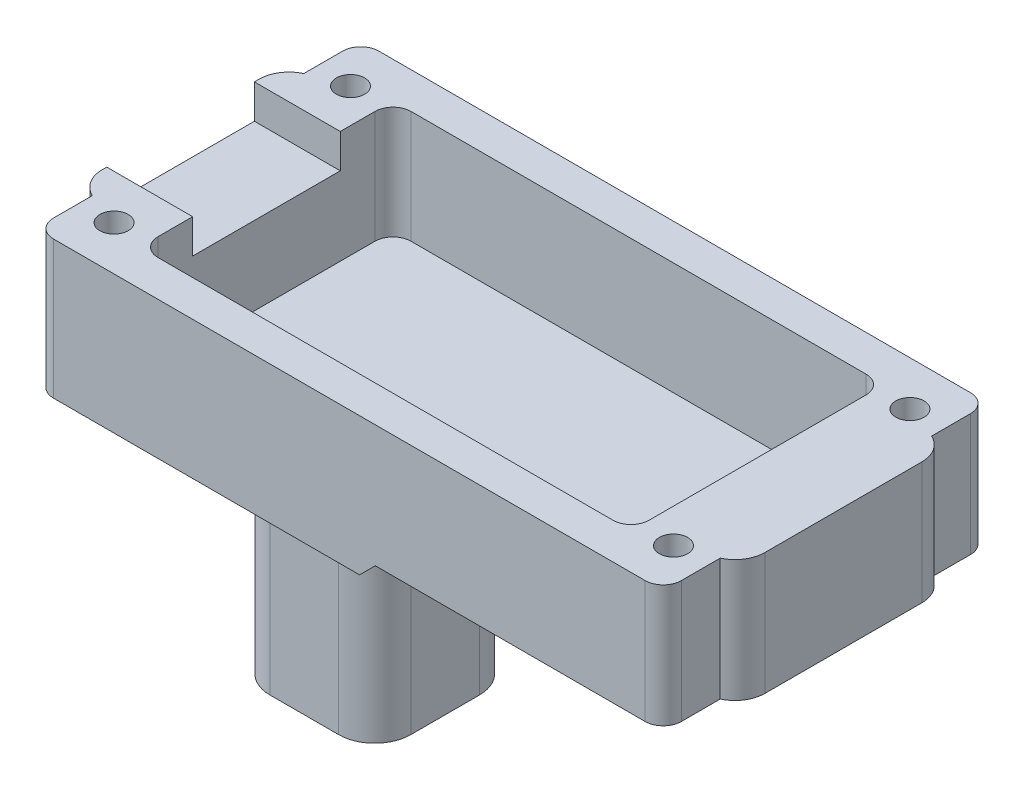
from build123d import *
from build123d.topology import SkipClean

# Parameters (mm, degrees)
SALIENTE_EXTRUIR1_DEPTH         = 9.33
SALIENTE_EXTRUIR2_START         = 1.5
SALIENTE_EXTRUIR2_DEPTH         = 1.5
CROQUIS3_R                      = 1.175
CORTAR_EXTRUIR1_DEPTH           = 60.671592069
CROQUIS4_R                      = 2.025
CORTAR_EXTRUIR2_DEPTH           = 2
CORTAR_EXTRUIR2_DRAFT           = -23
CORTAR_EXTRUIR2_PROFILE_2_DEPTH = 2
CORTAR_EXTRUIR2_PROFILE_2_DRAFT = -23
CORTAR_EXTRUIR2_PROFILE_3_DEPTH = 2
CORTAR_EXTRUIR2_PROFILE_3_DRAFT = -23
CORTAR_EXTRUIR2_PROFILE_4_DEPTH = 2
CORTAR_EXTRUIR2_PROFILE_4_DRAFT = -23
SALIENTE_EXTRUIR3_DEPTH         = 10.83
CROQUIS6_W                      = 12.25
CROQUIS6_H                      = 2.83
CORTAR_EXTRUIR3_DEPTH           = 56.750018404
SALIENTE_EXTRUIR4_DEPTH         = 20
CORTAR_EXTRUIR4_REACH           = 65.709
CHAFL_N1_SIZE                   = 1.3
SALIENTE_EXTRUIR5_DEPTH         = 0.61
SALIENTE_EXTRUIR6_DEPTH         = 0.61
CROQUIS12_R                     = 1.175
SALIENTE_EXTRUIR7_DEPTH         = 0.61
CROQUIS13_R                     = 2.025
CORTAR_EXTRUIR5_DEPTH           = 3
CROQUIS14_R                     = 2.025
CORTAR_EXTRUIR6_DEPTH           = 3
CROQUIS15_R                     = 2.025
CORTAR_EXTRUIR7_DEPTH           = 2
CORTAR_EXTRUIR7_DRAFT           = -23
CORTAR_EXTRUIR7_PROFILE_2_DEPTH = 2
CORTAR_EXTRUIR7_PROFILE_2_DRAFT = -23
CROQUIS16_R                     = 2.025
CORTAR_EXTRUIR8_DEPTH           = 4.31
CROQUIS17_R                     = 2.025
CORTAR_EXTRUIR9_DEPTH           = 2
CORTAR_EXTRUIR9_DRAFT           = -23
CORTAR_EXTRUIR9_PROFILE_2_DEPTH = 2
CORTAR_EXTRUIR9_PROFILE_2_DRAFT = -23
CROQUIS18_R                     = 2
CORTAR_EXTRUIR10_DEPTH          = 2


with BuildPart() as part:
    # Croquis1 → Saliente-Extruir1 (new body)
    with BuildSketch(Plane(origin=(0, 0, 0), x_dir=(1, 0, 0), z_dir=(0, 1, 0))):
        with BuildLine():
            Line((1.5, 0), (50.6, 0))
            ThreePointArc((50.6, 0), (51.660660172, 0.439339828), (52.1, 1.5))
            Line((52.1, 1.5), (52.1, 25.5))
            ThreePointArc((52.1, 25.5), (51.660660172, 26.560660172), (50.6, 27))
            Line((50.6, 27), (1.5, 27))
            ThreePointArc((1.5, 27), (0.439339828, 26.560660172), (0, 25.5))
            Line((0, 25.5), (0, 1.5))
            ThreePointArc((0, 1.5), (0.439339828, 0.439339828), (1.5, 0))
        make_face()
        with BuildLine():
            Line((7.175, 24), (44.925, 24))
            ThreePointArc((44.925, 24), (45.985660172, 23.560660172), (46.425, 22.5))
            Line((46.425, 22.5), (46.425, 4.5))
            ThreePointArc((46.425, 4.5), (45.985660172, 3.439339828), (44.925, 3))
            Line((44.925, 3), (7.175, 3))
            ThreePointArc((7.175, 3), (6.114339828, 3.439339828), (5.675, 4.5))
            Line((5.675, 4.5), (5.675, 22.5))
            ThreePointArc((5.675, 22.5), (6.114339828, 23.560660172), (7.175, 24))
        make_face(mode=Mode.SUBTRACT)
    extrude(amount=SALIENTE_EXTRUIR1_DEPTH)

    # Croquis2 → Saliente-Extruir2 (add)
    with BuildSketch(Plane.XZ.offset(SALIENTE_EXTRUIR2_START)):
        with BuildLine():
            Line((50.6, 0), (1.5, 0))
            ThreePointArc((1.5, 0), (0.439339828, -0.439339828), (0, -1.5))
            Line((0, -1.5), (0, -25.5))
            ThreePointArc((0, -25.5), (0.439339828, -26.560660172), (1.5, -27))
            Line((1.5, -27), (50.6, -27))
            ThreePointArc((50.6, -27), (51.660660172, -26.560660172), (52.1, -25.5))
            Line((52.1, -25.5), (52.1, -1.5))
            ThreePointArc((52.1, -1.5), (51.660660172, -0.439339828), (50.6, 0))
        make_face()
    extrude(amount=-SALIENTE_EXTRUIR2_DEPTH)

    # Croquis3 → Cortar-Extruir1 (cut, through all)
    with BuildSketch(Plane(origin=(0, 9.33, 0), x_dir=(1, 0, 0), z_dir=(0, 1, 0))):
        with Locations(Location((2.84, 23.31, 0), (0, 0, 270))):
            Circle(CROQUIS3_R)
        with Locations(Location((49.26, 23.31, 0), (0, 0, 90))):
            Circle(CROQUIS3_R)
        with Locations(Location((49.26, 3.69, 0), (0, 0, 270))):
            Circle(CROQUIS3_R)
        with Locations(Location((2.84, 3.69, 0), (0, 0, 90))):
            Circle(CROQUIS3_R)
    extrude(amount=-CORTAR_EXTRUIR1_DEPTH, mode=Mode.SUBTRACT)


with BuildPart() as cortar_extruir2_tool:
    # Croquis4 → Cortar-Extruir2 (with draft: the straight prism first)
    with BuildSketch(Plane.XZ.offset(1.5)):
        with Locations((49.26, -23.31)):
            Circle(CROQUIS4_R)
    extrude(amount=-CORTAR_EXTRUIR2_DEPTH)
    # Cortar-Extruir2: the draft: its side faces are tilted about the plane it starts from
    cortar_extruir2_sides = [cortar_extruir2_tool.faces().sort_by_distance(p)[0] for p in [
        (47.235, -0.5, -23.31),
    ]]
    draft(cortar_extruir2_sides, Plane.XZ.offset(1.5), CORTAR_EXTRUIR2_DRAFT)


with BuildPart() as part_1:
    add(part.part)

    # Cortar-Extruir2: cut by cortar_extruir2_tool
    add(cortar_extruir2_tool.part, mode=Mode.SUBTRACT)


with BuildPart() as cortar_extruir2_profile_2_tool:
    # Croquis4 → Cortar-Extruir2 profile 2 (with draft: the straight prism first)
    with BuildSketch(Plane.XZ.offset(1.5)):
        with Locations((2.84, -23.31)):
            Circle(CROQUIS4_R)
    extrude(amount=-CORTAR_EXTRUIR2_PROFILE_2_DEPTH)
    # Cortar-Extruir2 profile 2: the draft: its side faces are tilted about the plane it starts from
    cortar_extruir2_profile_2_sides = [cortar_extruir2_profile_2_tool.faces().sort_by_distance(p)[0] for p in [
        (0.815, -0.5, -23.31),
    ]]
    draft(cortar_extruir2_profile_2_sides, Plane.XZ.offset(1.5), CORTAR_EXTRUIR2_PROFILE_2_DRAFT)


with BuildPart() as part_2:
    add(part_1.part)

    # Cortar-Extruir2 profile 2: cut by cortar_extruir2_profile_2_tool
    add(cortar_extruir2_profile_2_tool.part, mode=Mode.SUBTRACT)


with BuildPart() as cortar_extruir2_profile_3_tool:
    # Croquis4 → Cortar-Extruir2 profile 3 (with draft: the straight prism first)
    with BuildSketch(Plane.XZ.offset(1.5)):
        with Locations((2.84, -3.69)):
            Circle(CROQUIS4_R)
    extrude(amount=-CORTAR_EXTRUIR2_PROFILE_3_DEPTH)
    # Cortar-Extruir2 profile 3: the draft: its side faces are tilted about the plane it starts from
    cortar_extruir2_profile_3_sides = [cortar_extruir2_profile_3_tool.faces().sort_by_distance(p)[0] for p in [
        (0.815, -0.5, -3.69),
    ]]
    draft(cortar_extruir2_profile_3_sides, Plane.XZ.offset(1.5), CORTAR_EXTRUIR2_PROFILE_3_DRAFT)


with BuildPart() as part_3:
    add(part_2.part)

    # Cortar-Extruir2 profile 3: cut by cortar_extruir2_profile_3_tool
    add(cortar_extruir2_profile_3_tool.part, mode=Mode.SUBTRACT)


with BuildPart() as cortar_extruir2_profile_4_tool:
    # Croquis4 → Cortar-Extruir2 profile 4 (with draft: the straight prism first)
    with BuildSketch(Plane.XZ.offset(1.5)):
        with Locations((49.26, -3.69)):
            Circle(CROQUIS4_R)
    extrude(amount=-CORTAR_EXTRUIR2_PROFILE_4_DEPTH)
    # Cortar-Extruir2 profile 4: the draft: its side faces are tilted about the plane it starts from
    cortar_extruir2_profile_4_sides = [cortar_extruir2_profile_4_tool.faces().sort_by_distance(p)[0] for p in [
        (47.235, -0.5, -3.69),
    ]]
    draft(cortar_extruir2_profile_4_sides, Plane.XZ.offset(1.5), CORTAR_EXTRUIR2_PROFILE_4_DRAFT)


with BuildPart() as part_4:
    add(part_3.part)

    # Cortar-Extruir2 profile 4: cut by cortar_extruir2_profile_4_tool
    add(cortar_extruir2_profile_4_tool.part, mode=Mode.SUBTRACT)

    # Croquis5 → Saliente-Extruir3 (add)
    with BuildSketch(Plane(origin=(0, 9.33, 0), x_dir=(1, 0, 0), z_dir=(0, 1, 0))):
        with BuildLine():
            Line((0, 22.27), (0, 4.73))
            ThreePointArc((0, 4.73), (-1.056857895, 5.653020288), (-1.45, 7))
            Line((-1.45, 7), (-1.45, 20))
            ThreePointArc((-1.45, 20), (-1.056857895, 21.346979712), (0, 22.27))
        make_face()
        with BuildLine():
            Line((53.55, 20), (53.55, 7))
            ThreePointArc((53.55, 7), (53.156857895, 5.653020288), (52.1, 4.73))
            Line((52.1, 4.73), (52.1, 22.27))
            ThreePointArc((52.1, 22.27), (53.156857895, 21.346979712), (53.55, 20))
        make_face()
    extrude(amount=-SALIENTE_EXTRUIR3_DEPTH)

    # Croquis6 → Cortar-Extruir3 (cut, through all)
    with BuildSketch(Plane(origin=(5.675, 0, 0), x_dir=(0, 0, -1), z_dir=(1, 0, 0))):
        with Locations((13.5, 7.915)):
            Rectangle(CROQUIS6_W, CROQUIS6_H)
    extrude(amount=-CORTAR_EXTRUIR3_DEPTH, mode=Mode.SUBTRACT)

    # Croquis7 → Saliente-Extruir4 (add)
    with BuildSketch(Plane.XZ.offset(1.5)):
        with BuildLine():
            Line((11.81, -19.35), (17.51, -19.35))
            ThreePointArc((17.51, -19.35), (19.631320344, -18.471320344), (20.51, -16.35))
            Line((20.51, -16.35), (20.51, -10.65))
            ThreePointArc((20.51, -10.65), (19.631320344, -8.528679656), (17.51, -7.65))
            Line((17.51, -7.65), (11.81, -7.65))
            ThreePointArc((11.81, -7.65), (9.688679656, -8.528679656), (8.81, -10.65))
            Line((8.81, -10.65), (8.81, -16.35))
            ThreePointArc((8.81, -16.35), (9.688679656, -18.471320344), (11.81, -19.35))
        make_face()
    extrude(amount=SALIENTE_EXTRUIR4_DEPTH)

    # Cortar-Extruir4: up to this face of the body (flat: up to its plane)
    cortar_extruir4_end = Plane(part_4.part.faces().sort_by_distance((26.05, 3.915, 0))[0])
    # Croquis8 → Cortar-Extruir4 (cut, up to the picked face)
    with BuildSketch(Plane(origin=(0, 0, -27), x_dir=(-1, 0, 0), z_dir=(0, 0, -1)), mode=Mode.PRIVATE) as cortar_extruir4_sk1:
        Polygon((-53.55, -0.19), (-28.2, -0.19), (-28.2, -1.5), (-28.55, -1.5), (-53.55, -1.5), (-53.55, -0.54), align=None)
    cortar_extruir4_tool1 = split(extrude(cortar_extruir4_sk1.sketch, amount=-CORTAR_EXTRUIR4_REACH, mode=Mode.PRIVATE), bisect_by=cortar_extruir4_end, keep=Keep.BOTH, mode=Mode.PRIVATE)
    add(cortar_extruir4_tool1.solids().sort_by(Axis((40.875, -0.845, -27), (0, 0, 1)))[0], mode=Mode.SUBTRACT)

    # Chaflán1
    chafl_n1_edges = [part_4.edges().sort_by_distance(p)[0] for p in [
        (28.2, -1.5, -13.5),
    ]]
    chamfer(chafl_n1_edges, length=CHAFL_N1_SIZE)

    # Croquis10 → Saliente-Extruir5 (add)
    with BuildSketch(Plane(origin=(0, 0, 0), x_dir=(1, 0, 0), z_dir=(0, 1, 0))):
        with BuildLine():
            Line((5.675, 22.5), (5.675, 4.5))
            ThreePointArc((5.675, 4.5), (6.114339828, 3.439339828), (7.175, 3))
            Line((7.175, 3), (44.925, 3))
            ThreePointArc((44.925, 3), (45.985660172, 3.439339828), (46.425, 4.5))
            Line((46.425, 4.5), (46.425, 22.5))
            ThreePointArc((46.425, 22.5), (45.985660172, 23.560660172), (44.925, 24))
            Line((44.925, 24), (7.175, 24))
            ThreePointArc((7.175, 24), (6.114339828, 23.560660172), (5.675, 22.5))
        make_face()
    extrude(amount=SALIENTE_EXTRUIR5_DEPTH)

    # Croquis11 → Saliente-Extruir6 (add)
    with BuildSketch(Plane(origin=(0, 6.5, 0), x_dir=(1, 0, 0), z_dir=(0, 1, 0))):
        Polygon((5.675, 7.375), (5.675, 19.625), (-1.45, 19.625), (-1.450000283, 7.375), align=None)
    extrude(amount=SALIENTE_EXTRUIR6_DEPTH)

    # Croquis12 → Saliente-Extruir7 (add)
    with SkipClean():  # the faces are left unmerged after this step: merging them gives an invalid solid
        with BuildSketch(Plane(origin=(0, 9.33, 0), x_dir=(1, 0, 0), z_dir=(0, 1, 0))):
            with BuildLine():
                Line((5.675, 7.375), (-1.450000283, 7.375))
                Line((-1.450000283, 7.375), (-1.45, 7))
                ThreePointArc((-1.45, 7), (-1.056857895, 5.653020288), (0, 4.73))
                Line((0, 4.73), (0, 1.5))
                ThreePointArc((0, 1.5), (0.439339828, 0.439339828), (1.5, 0))
                Line((1.5, 0), (50.6, 0))
                ThreePointArc((50.6, 0), (51.660660172, 0.439339828), (52.1, 1.5))
                Line((52.1, 1.5), (52.1, 4.73))
                ThreePointArc((52.1, 4.73), (53.156857895, 5.653020288), (53.55, 7))
                Line((53.55, 7), (53.55, 20))
                ThreePointArc((53.55, 20), (53.156857895, 21.346979712), (52.1, 22.27))
                Line((52.1, 22.27), (52.1, 25.5))
                ThreePointArc((52.1, 25.5), (51.660660172, 26.560660172), (50.6, 27))
                Line((50.6, 27), (1.5, 27))
                ThreePointArc((1.5, 27), (0.439339828, 26.560660172), (0, 25.5))
                Line((0, 25.5), (0, 22.27))
                ThreePointArc((0, 22.27), (-1.056857895, 21.346979712), (-1.45, 20))
                Line((-1.45, 20), (-1.450000283, 19.625))
                Line((-1.450000283, 19.625), (5.675, 19.625))
                Line((5.675, 19.625), (5.675, 22.5))
                ThreePointArc((5.675, 22.5), (6.114339828, 23.560660172), (7.175, 24))
                Line((7.175, 24), (44.925, 24))
                ThreePointArc((44.925, 24), (45.985660172, 23.560660172), (46.425, 22.5))
                Line((46.425, 22.5), (46.425, 4.5))
                ThreePointArc((46.425, 4.5), (45.985660172, 3.439339828), (44.925, 3))
                Line((44.925, 3), (7.175, 3))
                ThreePointArc((7.175, 3), (6.114339828, 3.439339828), (5.675, 4.5))
                Line((5.675, 4.5), (5.675, 7.375))
            make_face()
            with Locations(Location((49.26, 3.69, 0), (0, 0, 270))):
                Circle(CROQUIS12_R, mode=Mode.SUBTRACT)
            with Locations(Location((2.84, 3.69, 0), (0, 0, 270))):
                Circle(CROQUIS12_R, mode=Mode.SUBTRACT)
            with Locations(Location((2.84, 23.31, 0), (0, 0, 270))):
                Circle(CROQUIS12_R, mode=Mode.SUBTRACT)
            with Locations(Location((49.26, 23.31, 0), (0, 0, 270))):
                Circle(CROQUIS12_R, mode=Mode.SUBTRACT)
        extrude(amount=SALIENTE_EXTRUIR7_DEPTH)
    add(part_4.part.scale(1), mode=Mode.REPLACE)  # the faces are merged on a copy

    # Croquis13 → Cortar-Extruir5 (cut)
    with BuildSketch(Plane.XZ.offset(0.19)):
        with Locations(Location((49.26, -3.69, 0), (0, 0, 270))):
            Circle(CROQUIS13_R)
    extrude(amount=-CORTAR_EXTRUIR5_DEPTH, mode=Mode.SUBTRACT)

    # Croquis14 → Cortar-Extruir6 (cut)
    with BuildSketch(Plane.XZ.offset(0.19)):
        with Locations(Location((49.26, -23.31, 0), (0, 0, 270))):
            Circle(CROQUIS14_R)
    extrude(amount=-CORTAR_EXTRUIR6_DEPTH, mode=Mode.SUBTRACT)


with BuildPart() as cortar_extruir7_tool:
    # Croquis15 → Cortar-Extruir7 (with draft: the straight prism first)
    with BuildSketch(Plane.XZ.offset(-2.81)):
        with Locations(Location((49.26, -3.69, 0), (0, 0, 270))):
            Circle(CROQUIS15_R)
    extrude(amount=-CORTAR_EXTRUIR7_DEPTH)
    # Cortar-Extruir7: the draft: its side faces are tilted about the plane it starts from
    cortar_extruir7_sides = [cortar_extruir7_tool.faces().sort_by_distance(p)[0] for p in [
        (49.26, 3.81, -1.665),
    ]]
    draft(cortar_extruir7_sides, Plane.XZ.offset(-2.81), CORTAR_EXTRUIR7_DRAFT)


with BuildPart() as part_5:
    add(part_4.part)

    # Cortar-Extruir7: cut by cortar_extruir7_tool
    add(cortar_extruir7_tool.part, mode=Mode.SUBTRACT)


with BuildPart() as cortar_extruir7_profile_2_tool:
    # Croquis15 → Cortar-Extruir7 profile 2 (with draft: the straight prism first)
    with BuildSketch(Plane.XZ.offset(-2.81)):
        with Locations(Location((49.26, -23.31, 0), (0, 0, 270))):
            Circle(CROQUIS15_R)
    extrude(amount=-CORTAR_EXTRUIR7_PROFILE_2_DEPTH)
    # Cortar-Extruir7 profile 2: the draft: its side faces are tilted about the plane it starts from
    cortar_extruir7_profile_2_sides = [cortar_extruir7_profile_2_tool.faces().sort_by_distance(p)[0] for p in [
        (49.26, 3.81, -21.285),
    ]]
    draft(cortar_extruir7_profile_2_sides, Plane.XZ.offset(-2.81), CORTAR_EXTRUIR7_PROFILE_2_DRAFT)


with BuildPart() as part_6:
    add(part_5.part)

    # Cortar-Extruir7 profile 2: cut by cortar_extruir7_profile_2_tool
    add(cortar_extruir7_profile_2_tool.part, mode=Mode.SUBTRACT)

    # Croquis16 → Cortar-Extruir8 (cut)
    with BuildSketch(Plane.XZ.offset(1.5)):
        with Locations(Location((2.84, -23.31, 0), (0, 0, 270))):
            Circle(CROQUIS16_R)
        with Locations(Location((2.84, -3.69, 0), (0, 0, 270))):
            Circle(CROQUIS16_R)
    extrude(amount=-CORTAR_EXTRUIR8_DEPTH, mode=Mode.SUBTRACT)


with BuildPart() as cortar_extruir9_tool:
    # Croquis17 → Cortar-Extruir9 (with draft: the straight prism first)
    with BuildSketch(Plane.XZ.offset(-2.81)):
        with Locations(Location((2.84, -3.69, 0), (0, 0, 270))):
            Circle(CROQUIS17_R)
    extrude(amount=-CORTAR_EXTRUIR9_DEPTH)
    # Cortar-Extruir9: the draft: its side faces are tilted about the plane it starts from
    cortar_extruir9_sides = [cortar_extruir9_tool.faces().sort_by_distance(p)[0] for p in [
        (2.84, 3.81, -1.665),
    ]]
    draft(cortar_extruir9_sides, Plane.XZ.offset(-2.81), CORTAR_EXTRUIR9_DRAFT)


with BuildPart() as part_7:
    add(part_6.part)

    # Cortar-Extruir9: cut by cortar_extruir9_tool
    add(cortar_extruir9_tool.part, mode=Mode.SUBTRACT)


with BuildPart() as cortar_extruir9_profile_2_tool:
    # Croquis17 → Cortar-Extruir9 profile 2 (with draft: the straight prism first)
    with BuildSketch(Plane.XZ.offset(-2.81)):
        with Locations(Location((2.84, -23.31, 0), (0, 0, 270))):
            Circle(CROQUIS17_R)
    extrude(amount=-CORTAR_EXTRUIR9_PROFILE_2_DEPTH)
    # Cortar-Extruir9 profile 2: the draft: its side faces are tilted about the plane it starts from
    cortar_extruir9_profile_2_sides = [cortar_extruir9_profile_2_tool.faces().sort_by_distance(p)[0] for p in [
        (2.84, 3.81, -21.285),
    ]]
    draft(cortar_extruir9_profile_2_sides, Plane.XZ.offset(-2.81), CORTAR_EXTRUIR9_PROFILE_2_DRAFT)


with BuildPart() as part_8:
    add(part_7.part)

    # Cortar-Extruir9 profile 2: cut by cortar_extruir9_profile_2_tool
    add(cortar_extruir9_profile_2_tool.part, mode=Mode.SUBTRACT)

    # Croquis18 → Cortar-Extruir10 (cut)
    with BuildSketch(Plane.ZY.offset(-8.81)):
        with Locations((-13.5, -11.5)):
            Circle(CROQUIS18_R)
    extrude(amount=-CORTAR_EXTRUIR10_DEPTH, mode=Mode.SUBTRACT)


solid = part_8.part
